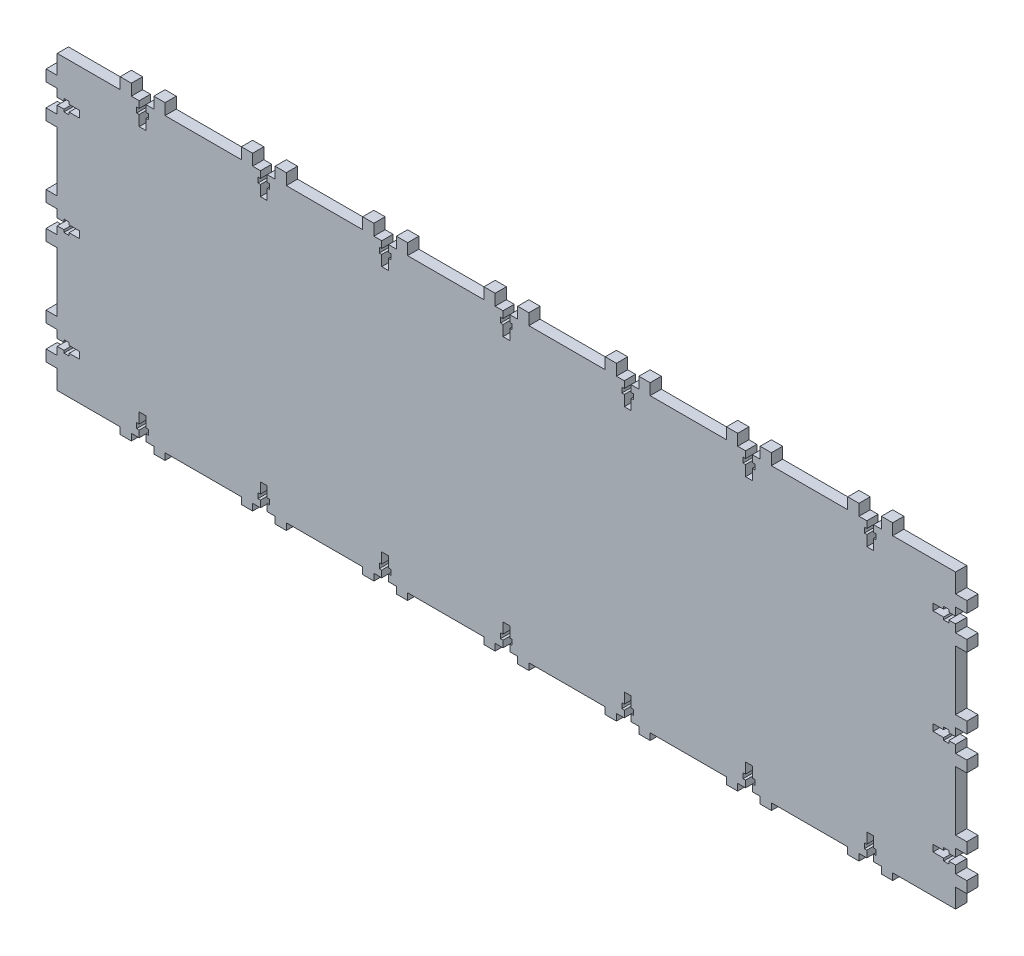
from build123d import *

# Parameters (mm, degrees)
BOSS_EXTRUDE1_DEPTH = 5
CUT_EXTRUDE1_START  = -5
SKETCH2_W           = 344
SKETCH2_H           = 2
CUT_EXTRUDE1_DEPTH  = 5


# Read off the part's stored shape, not the designer's step: Boss-Extrude1
with BuildPart() as part:
    # Boss-Extrude1 outline → Boss-Extrude1 (new body)
    with BuildSketch(Plane.XY):
        Polygon((-200, 65), (-200, 56.5), (-205, 56.5), (-205, 51.5), (-200, 51.5), (-200, 48), (-197, 48), (-197, 49.1), (-194.7, 49.1), (-194.7, 48), (-190, 48), (-190, 45), (-194.7, 45), (-194.7, 43.9), (-197, 43.9), (-197, 45), (-200, 45), (-200, 41.5), (-205, 41.5), (-205, 36.5), (-200, 36.5), (-200, 10), (-205, 10), (-205, 5), (-200, 5), (-200, 1.5), (-197, 1.5), (-197, 2.6), (-194.7, 2.6), (-194.7, 1.5), (-190, 1.5), (-190, -1.5), (-194.7, -1.5), (-194.7, -2.6), (-197, -2.6), (-197, -1.5), (-200, -1.5), (-200, -5), (-205, -5), (-205, -10), (-200, -10), (-200, -36.5), (-205, -36.5), (-205, -41.5), (-200, -41.5), (-200, -45), (-197, -45), (-197, -43.9), (-194.7, -43.9), (-194.7, -45), (-190, -45), (-190, -48), (-194.7, -48), (-194.7, -49.1), (-197, -49.1), (-197, -48), (-200, -48), (-200, -51.5), (-205, -51.5), (-205, -56.5), (-200, -56.5), (-200, -65), (-172, -65), (-172, -70), (-167, -70), (-167, -65), (-163.5, -65), (-163.5, -62), (-164.6, -62), (-164.6, -59.7), (-163.5, -59.7), (-163.5, -55), (-160.5, -55), (-160.5, -59.7), (-159.4, -59.7), (-159.4, -62), (-160.5, -62), (-160.5, -65), (-157, -65), (-157, -70), (-152, -70), (-152, -65), (-118, -65), (-118, -70), (-113, -70), (-113, -65), (-109.5, -65), (-109.5, -62), (-110.6, -62), (-110.6, -59.7), (-109.5, -59.7), (-109.5, -55), (-106.5, -55), (-106.5, -59.7), (-105.4, -59.7), (-105.4, -62), (-106.5, -62), (-106.5, -65), (-103, -65), (-103, -70), (-98, -70), (-98, -65), (-64, -65), (-64, -70), (-59, -70), (-59, -65), (-55.5, -65), (-55.5, -62), (-56.6, -62), (-56.6, -59.7), (-55.5, -59.7), (-55.5, -55), (-52.5, -55), (-52.5, -59.7), (-51.4, -59.7), (-51.4, -62), (-52.5, -62), (-52.5, -65), (-49, -65), (-49, -70), (-44, -70), (-44, -65), (-10, -65), (-10, -70), (-5, -70), (-5, -65), (-1.5, -65), (-1.5, -62), (-2.6, -62), (-2.6, -59.7), (-1.5, -59.7), (-1.5, -55), (1.5, -55), (1.5, -59.7), (2.6, -59.7), (2.6, -62), (1.5, -62), (1.5, -65), (5, -65), (5, -70), (10, -70), (10, -65), (44, -65), (44, -70), (49, -70), (49, -65), (52.5, -65), (52.5, -62), (51.4, -62), (51.4, -59.7), (52.5, -59.7), (52.5, -55), (55.5, -55), (55.5, -59.7), (56.6, -59.7), (56.6, -62), (55.5, -62), (55.5, -65), (59, -65), (59, -70), (64, -70), (64, -65), (98, -65), (98, -70), (103, -70), (103, -65), (106.5, -65), (106.5, -62), (105.4, -62), (105.4, -59.7), (106.5, -59.7), (106.5, -55), (109.5, -55), (109.5, -59.7), (110.6, -59.7), (110.6, -62), (109.5, -62), (109.5, -65), (113, -65), (113, -70), (118, -70), (118, -65), (152, -65), (152, -70), (157, -70), (157, -65), (160.5, -65), (160.5, -62), (159.4, -62), (159.4, -59.7), (160.5, -59.7), (160.5, -55), (163.5, -55), (163.5, -59.7), (164.6, -59.7), (164.6, -62), (163.5, -62), (163.5, -65), (167, -65), (167, -70), (172, -70), (172, -65), (200, -65), (200, -56.5), (205, -56.5), (205, -51.5), (200, -51.5), (200, -48), (197, -48), (197, -49.1), (194.7, -49.1), (194.7, -48), (190, -48), (190, -45), (194.7, -45), (194.7, -43.9), (197, -43.9), (197, -45), (200, -45), (200, -41.5), (205, -41.5), (205, -36.5), (200, -36.5), (200, -10), (205, -10), (205, -5), (200, -5), (200, -1.5), (197, -1.5), (197, -2.6), (194.7, -2.6), (194.7, -1.5), (190, -1.5), (190, 1.5), (194.7, 1.5), (194.7, 2.6), (197, 2.6), (197, 1.5), (200, 1.5), (200, 5), (205, 5), (205, 10), (200, 10), (200, 36.5), (205, 36.5), (205, 41.5), (200, 41.5), (200, 45), (197, 45), (197, 43.9), (194.7, 43.9), (194.7, 45), (190, 45), (190, 48), (194.7, 48), (194.7, 49.1), (197, 49.1), (197, 48), (200, 48), (200, 51.5), (205, 51.5), (205, 56.5), (200, 56.5), (200, 65), (172, 65), (172, 70), (167, 70), (167, 65), (163.5, 65), (163.5, 62), (164.6, 62), (164.6, 59.7), (163.5, 59.7), (163.5, 55), (160.5, 55), (160.5, 59.7), (159.4, 59.7), (159.4, 62), (160.5, 62), (160.5, 65), (157, 65), (157, 70), (152, 70), (152, 65), (118, 65), (118, 70), (113, 70), (113, 65), (109.5, 65), (109.5, 62), (110.6, 62), (110.6, 59.7), (109.5, 59.7), (109.5, 55), (106.5, 55), (106.5, 59.7), (105.4, 59.7), (105.4, 62), (106.5, 62), (106.5, 65), (103, 65), (103, 70), (98, 70), (98, 65), (64, 65), (64, 70), (59, 70), (59, 65), (55.5, 65), (55.5, 62), (56.6, 62), (56.6, 59.7), (55.5, 59.7), (55.5, 55), (52.5, 55), (52.5, 59.7), (51.4, 59.7), (51.4, 62), (52.5, 62), (52.5, 65), (49, 65), (49, 70), (44, 70), (44, 65), (10, 65), (10, 70), (5, 70), (5, 65), (1.5, 65), (1.5, 62), (2.6, 62), (2.6, 59.7), (1.5, 59.7), (1.5, 55), (-1.5, 55), (-1.5, 59.7), (-2.6, 59.7), (-2.6, 62), (-1.5, 62), (-1.5, 65), (-5, 65), (-5, 70), (-10, 70), (-10, 65), (-44, 65), (-44, 70), (-49, 70), (-49, 65), (-52.5, 65), (-52.5, 62), (-51.4, 62), (-51.4, 59.7), (-52.5, 59.7), (-52.5, 55), (-55.5, 55), (-55.5, 59.7), (-56.6, 59.7), (-56.6, 62), (-55.5, 62), (-55.5, 65), (-59, 65), (-59, 70), (-64, 70), (-64, 65), (-98, 65), (-98, 70), (-103, 70), (-103, 65), (-106.5, 65), (-106.5, 62), (-105.4, 62), (-105.4, 59.7), (-106.5, 59.7), (-106.5, 55), (-109.5, 55), (-109.5, 59.7), (-110.6, 59.7), (-110.6, 62), (-109.5, 62), (-109.5, 65), (-113, 65), (-113, 70), (-118, 70), (-118, 65), (-152, 65), (-152, 70), (-157, 70), (-157, 65), (-160.5, 65), (-160.5, 62), (-159.4, 62), (-159.4, 59.7), (-160.5, 59.7), (-160.5, 55), (-163.5, 55), (-163.5, 59.7), (-164.6, 59.7), (-164.6, 62), (-163.5, 62), (-163.5, 65), (-167, 65), (-167, 70), (-172, 70), (-172, 65), align=None)
    extrude(amount=BOSS_EXTRUDE1_DEPTH)

    # Sketch2 → Cut-Extrude1 (cut)
    with BuildSketch(Plane.XY.offset(5).offset(CUT_EXTRUDE1_START)):
        with Locations((0, -69)):
            Rectangle(SKETCH2_W, SKETCH2_H)
    extrude(amount=CUT_EXTRUDE1_DEPTH, mode=Mode.SUBTRACT)


solid = part.part
